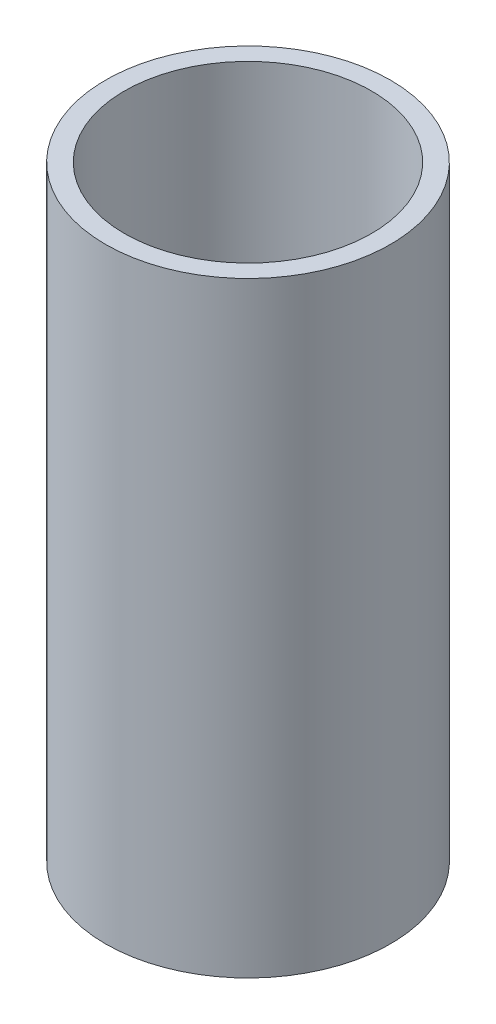
from build123d import *

# Parameters (mm, degrees)
SKETCH1_R           = 47.5
BOSS_EXTRUDE1_DEPTH = 202.082616026
SKETCH2_R           = 41.211748076
CUT_EXTRUDE1_DEPTH  = 213.955121328


with BuildPart() as part:
    # Sketch1 → Boss-Extrude1 (new body)
    with BuildSketch(Plane(origin=(0, 0, 0), x_dir=(1, 0, 0), z_dir=(0, 1, 0))):
        Circle(SKETCH1_R)
    extrude(amount=BOSS_EXTRUDE1_DEPTH)

    # Sketch2 → Cut-Extrude1 (cut, through all)
    with BuildSketch(Plane(origin=(0, 0, 0), x_dir=(1, 0, 0), z_dir=(0, 1, 0))):
        Circle(SKETCH2_R)
    extrude(amount=CUT_EXTRUDE1_DEPTH, mode=Mode.SUBTRACT)


solid = part.part
